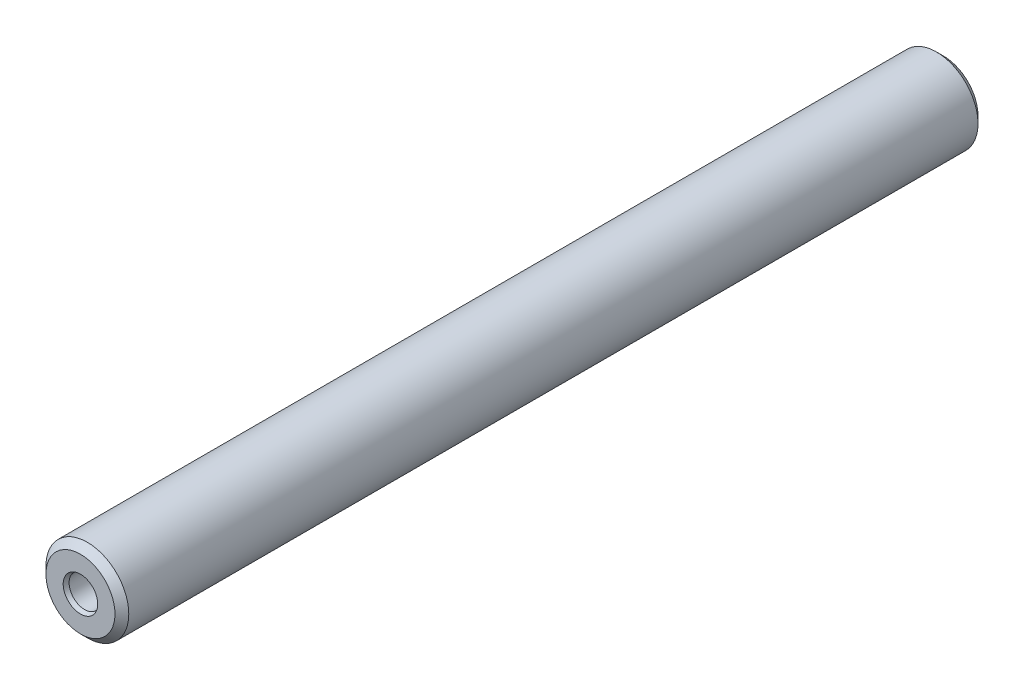
from build123d import *

# Parameters (mm, degrees)
ESQUISSE1_R                = 6
EXTRUSION1_DEPTH           = 125
CHANFREIN1_SIZE            = 1
D_GAGEMENT_M42_D           = 4.5
D_GAGEMENT_M42_DEPTH       = 11
D_GAGEMENT_M42_CSINK_D     = 5
D_GAGEMENT_M42_CSINK_ANGLE = 45
D_GAGEMENT_M42_TIP         = 1.351936


with BuildPart() as part:
    # Esquisse1 → Extrusion1 (new body)
    with BuildSketch(Plane.XY):
        Circle(ESQUISSE1_R)
    extrude(amount=EXTRUSION1_DEPTH)

    # Chanfrein1
    chanfrein1_edges = [part.edges().sort_by_distance(p)[0] for p in [
        (-6, 0, 0),
        (-6, 0, 125),
    ]]
    chamfer(chanfrein1_edges, length=CHANFREIN1_SIZE)

    # Esquisse4 → Dégagement M41 (revolve, cut)
    with BuildSketch(Plane(origin=(0, 0, 125), x_dir=(0, -1, 0), z_dir=(1, 0, 0))):
        Polygon((0, 0), (0, 12.351936), (2.25, 11), (2.25, 0.603553), (2.5, 0), align=None)
    revolve(axis=Axis((0, 0, 131.35), (0, 0, -1)), mode=Mode.SUBTRACT)

    # Dégagement M42
    with Locations(Plane(origin=(0, 0, 0), x_dir=(-1, 0, 0), z_dir=(0, 0, -1))):
        with Locations((0, 0), (1e-06, -1e-06), (-2e-06, -2e-06)):
            CounterSinkHole(D_GAGEMENT_M42_D / 2, D_GAGEMENT_M42_CSINK_D / 2, depth=D_GAGEMENT_M42_DEPTH, counter_sink_angle=D_GAGEMENT_M42_CSINK_ANGLE)
            with Locations((0, 0, -(D_GAGEMENT_M42_DEPTH + D_GAGEMENT_M42_TIP / 2))):  # 118° drill point
                Cone(0, D_GAGEMENT_M42_D / 2, D_GAGEMENT_M42_TIP, mode=Mode.SUBTRACT)


solid = part.part
